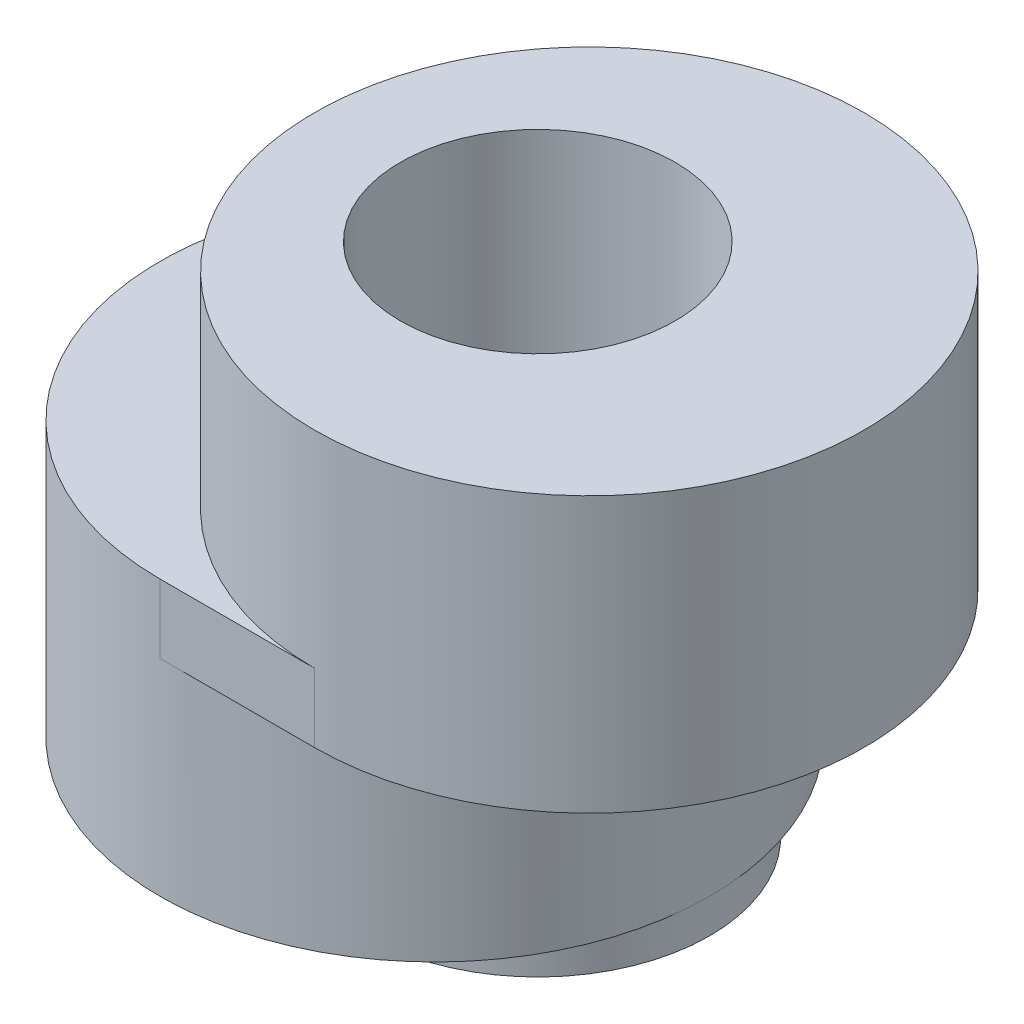
from build123d import *
from build123d.topology import SkipClean

# Parameters (mm, degrees)
SKETCH_1_R      = 4
SKETCH_1_R_2    = 2
EXTRUDE_1_DEPTH = 3
SKETCH_2_R      = 2
EXTRUDE_2_DEPTH = 1
SKETCH_3_R      = 4
SKETCH_3_R_2    = 2
EXTRUDE_3_DEPTH = 3
EXTRUDE_START   = 0.5
SKETCH_4_R      = 2.5
SKETCH_4_R_2    = 2
EXTRUDE_4_DEPTH = 0.5


with BuildPart() as part:
    # 草图1 → 凸台-拉伸1 (new body)
    with BuildSketch(Plane(origin=(0, 0, 0), x_dir=(1, 0, 0), z_dir=(0, 1, 0))):
        with Locations((-1.5, 0)):
            Circle(SKETCH_1_R)
        Circle(SKETCH_1_R_2, mode=Mode.SUBTRACT)
    extrude(amount=EXTRUDE_1_DEPTH)

    # 草图2 → 凸台-拉伸2 (add)
    with BuildSketch(Plane(origin=(0, 3, 0), x_dir=(1, 0, 0), z_dir=(0, 1, 0))):
        with BuildLine():
            Line((-1.5, 4), (0.75, 4))
            ThreePointArc((0.75, 4), (4.75, 0), (0.75, -4))
            Line((0.75, -4), (-1.5, -4))
            ThreePointArc((-1.5, -4), (-5.5, 0), (-1.5, 4))
        make_face()
        Circle(SKETCH_2_R, mode=Mode.SUBTRACT)
    extrude(amount=EXTRUDE_2_DEPTH)

    # 草图3 → 凸台-拉伸3 (add)
    with SkipClean():  # the faces are left unmerged after this step: merging them gives an invalid solid
        with BuildSketch(Plane(origin=(0, 4, 0), x_dir=(1, 0, 0), z_dir=(0, 1, 0))):
            with Locations((0.75, 0)):
                Circle(SKETCH_3_R)
            Circle(SKETCH_3_R_2, mode=Mode.SUBTRACT)
        extrude(amount=EXTRUDE_3_DEPTH)
    add(part.part.scale(1), mode=Mode.REPLACE)  # the faces are merged on a copy

    # 草图4 → 凸台-拉伸4 (add)
    with BuildSketch(Plane.XZ.offset(EXTRUDE_START)):
        Circle(SKETCH_4_R)
        Circle(SKETCH_4_R_2, mode=Mode.SUBTRACT)
    extrude(amount=-EXTRUDE_4_DEPTH)


solid = part.part
